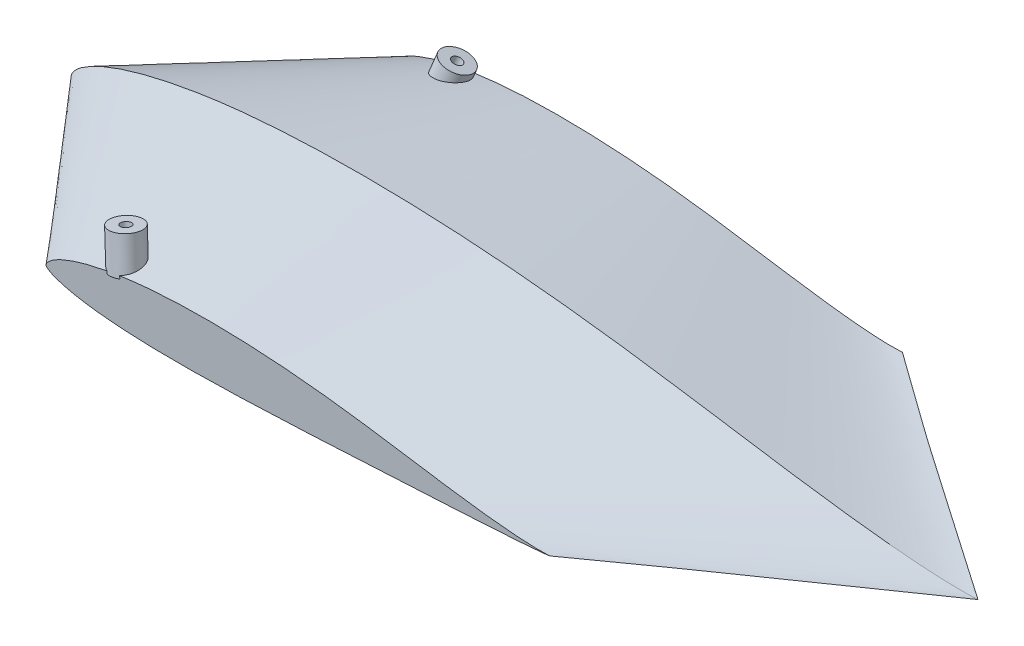
from build123d import *


with BuildPart() as part:
    # Body: read off the stored shape, not the designer's step
    # Body: loft between two sections, ruled curve by curve
    body_from = [
        Edge.make_bspline([(55.386771949, 11.883403368, 0), (55.852768765, 11.8868564, 0), (56.69562124, 11.89107863, 0), (59.94104569, 11.893656358, 0), (63.097215642, 11.853355335, 0), (68.366157994, 11.720868986, 0), (71.608923872, 11.59851596, 0), (77.026588338, 11.330029908, 0), (80.330447299, 11.126685225, 0), (85.847005897, 10.724944533, 0), (89.187094514, 10.443802673, 0), (94.75473633, 9.914693256, 0), (98.107627196, 9.559572712, 0), (103.681588987, 8.914690299, 0), (107.025673921, 8.495570086, 0), (112.562901545, 7.754939466, 0), (115.876650644, 7.284538974, 0), (121.334596116, 6.47861219, 0), (124.597392632, 5.979635356, 0), (129.924247429, 5.158494984, 0), (133.105917394, 4.66611092, 0), (138.229918356, 3.884653763, 0), (141.289972849, 3.425809537, 0), (146.12556764, 2.725195147, 0), (149.019747564, 2.320659658, 0), (153.479700678, 1.73306452, 0), (156.166253706, 1.400021675, 0), (160.153026967, 0.948983625, 0), (162.575234086, 0.699489944, 0), (166.008656714, 0.395886817, 0), (168.14749804, 0.234691756, 0), (170.900623314, 0.059264479, 0), (172.636575103, -0.035133887, 0), (174.735166131, -0.096211558, 0), (176.240928901, -0.109171411, 0), (177.443657202, -0.106955701, 0), (178.111324255, -0.102823971, 0), (178.692575161, -0.08298795, 0), (179.171022705, -0.054192073, 0), (179.705914343, -0.015962785, 0), (180.287534727, 0.029034431, 0), (179.41983786, -0.079190012, 0), (178.554256528, -0.191311882, 0), (177.734403332, -0.300407627, 0), (176.491964699, -0.431879969, 0), (174.691835688, -0.598099294, 0), (173.122720973, -0.722301039, 0), (170.809437199, -0.890644015, 0), (168.904268633, -1.022781588, 0), (165.920571198, -1.221295378, 0), (163.72362128, -1.360413519, 0), (160.179665219, -1.579480384, 0), (157.701595525, -1.729637928, 0), (153.623230876, -1.97266118, 0), (150.895153303, -2.132288806, 0), (146.345753164, -2.396056672, 0), (143.395613127, -2.565710461, 0), (138.434163256, -2.847752541, 0), (135.294196529, -3.023914124, 0), (129.986544453, -3.318842214, 0), (126.690069866, -3.500261624, 0), (121.104982217, -3.803854389, 0), (117.687513647, -3.987136439, 0), (111.89776573, -4.293629527, 0), (108.396548253, -4.476495579, 0), (102.477580795, -4.779250682, 0), (98.930780488, -4.95660358, 0), (92.959573997, -5.246695702, 0), (89.405980253, -5.41414178, 0), (83.459411347, -5.680855724, 0), (79.937050776, -5.830553211, 0), (74.090091141, -6.060795327, 0), (70.635861673, -6.185921231, 0), (64.959424417, -6.364933713, 0), (61.60728337, -6.45477053, 0), (56.165928072, -6.567217659, 0), (52.946479073, -6.614266161, 0), (47.798079896, -6.647306632, 0), (44.738678748, -6.642336362, 0), (39.933929516, -6.585936307, 0), (37.058156123, -6.524165358, 0), (32.64149365, -6.373849561, 0), (29.970676549, -6.250893361, 0), (25.98099515, -6.007108108, 0), (23.53348793, -5.822813571, 0), (20.004163285, -5.49109927, 0), (17.796276037, -5.244883205, 0), (14.754853341, -4.836637096, 0), (12.799889299, -4.533212775, 0), (10.270045435, -4.069656304, 0), (8.581347581, -3.716988448, 0), (6.586979055, -3.226447641, 0), (5.1807037, -2.83284361, 0), (3.739952211, -2.354956574, 0), (2.710801788, -1.965425391, 0), (1.97524414, -1.624570837, 0), (1.587735948, -1.420817945, 0), (1.34594803, -1.286938724, 0), (1.125729324, -1.156215034, 0), (0.935880593, -1.033338684, 0), (0.830512807, -0.961788322, 0), (0.736839333, -0.896352411, 0), (0.616620624, -0.808372944, 0), (0.519553217, -0.730934489, 0), (0.381481001, -0.614079034, 0), (0.288101728, -0.526787177, 0), (0.159180295, -0.380481821, 0), (0.076929066, -0.273589188, 0), (0.021915576, -0.155797955, 0), (-0.003466005, -0.044628629, 0), (-0.001633065, 0.085626904, 0), (0.057873164, 0.315835161, 0), (0.151614071, 0.522041136, 0), (0.276137416, 0.738604536, 0), (0.511935862, 1.088517205, 0), (0.996715371, 1.620829181, 0), (1.76013298, 2.273902068, 0), (2.824399816, 3.008266903, 0), (3.973909572, 3.670046578, 0), (5.54254929, 4.451573216, 0), (6.97471876, 5.065600577, 0), (9.043677576, 5.851293471, 0), (10.738427676, 6.414868774, 0), (13.288922977, 7.173313491, 0), (15.229725214, 7.681725206, 0), (18.238216005, 8.38720106, 0), (20.407556479, 8.834857167, 0), (23.843408677, 9.464545106, 0), (26.222677617, 9.843555786, 0), (30.053960093, 10.373668862, 0), (32.626340955, 10.673112228, 0), (36.822716684, 11.082650055, 0), (39.572058951, 11.297347101, 0), (44.100145874, 11.575668127, 0), (47.007269208, 11.704670259, 0), (51.362247986, 11.832903484, 0), (53.56285102, 11.869888129, 0), (55.386771949, 11.883403368, 0)], [0, 0, 0, 0, 0.003833429, 0.006933429, 0.02669708, 0.02979708, 0.050290098, 0.053390098, 0.074418303, 0.077518303, 0.098890395, 0.101990395, 0.123525188, 0.126625188, 0.14814885, 0.15124885, 0.17258157, 0.17568157, 0.196634381, 0.199734381, 0.220019886, 0.223119886, 0.242372939, 0.245472939, 0.263316714, 0.266416714, 0.282471263, 0.285571263, 0.299445276, 0.302545276, 0.313857938, 0.316957938, 0.325412787, 0.328512787, 0.333853157, 0.336953157, 0.338931106, 0.3406, 0.342031106, 0.342180142, 0.3437, 0.345280142, 0.346690499, 0.349790499, 0.35391197, 0.35701197, 0.363844606, 0.366944606, 0.376403979, 0.379503979, 0.391434562, 0.394534562, 0.408749538, 0.411849538, 0.428132732, 0.431232732, 0.449340879, 0.452440879, 0.472112248, 0.475212248, 0.496171182, 0.499271182, 0.521224922, 0.524324922, 0.54696643, 0.55006643, 0.573080114, 0.576180114, 0.599245624, 0.602345624, 0.62514787, 0.62824787, 0.650481982, 0.653581982, 0.674967352, 0.678067352, 0.698353756, 0.701453756, 0.72042038, 0.72352038, 0.740981358, 0.744081358, 0.759873573, 0.762973573, 0.776961874, 0.780061874, 0.792133285, 0.795233285, 0.805304457, 0.808404457, 0.81638728, 0.81948728, 0.825299011, 0.828399011, 0.831963921, 0.834324273, 0.835063921, 0.835564661, 0.836596336, 0.837168722, 0.837424273, 0.837643814, 0.838108431, 0.838649366, 0.838664661, 0.839594519, 0.839696336, 0.840268722, 0.840701999, 0.840743814, 0.841208431, 0.841749366, 0.842694519, 0.843060542, 0.843801999, 0.846160542, 0.848952704, 0.852052704, 0.85675218, 0.85985218, 0.866461296, 0.869561296, 0.878046999, 0.881146999, 0.891445777, 0.894545777, 0.90656294, 0.90966294, 0.923277977, 0.926377977, 0.941478014, 0.944578014, 0.961060385, 0.964160385, 0.981895882, 0.984995882, 1, 1, 1, 1], 3),
    ]
    body_to = [
        Edge.make_bspline([(61.398503394, 6.605335104, -35), (61.657396006, 6.606260191, -35), (62.125652412, 6.606835836, -35), (63.928651223, 6.60163665, -35), (65.681992456, 6.57312672, -35), (68.608917692, 6.489851366, -35), (70.410229938, 6.416135293, -35), (73.41956614, 6.257732568, -35), (75.254702124, 6.13932317, -35), (78.318803302, 5.907378116, -35), (80.173966346, 5.746022718, -35), (83.266287376, 5.443688046, -35), (85.128497374, 5.241647014, -35), (88.224270727, 4.875974842, -35), (90.081575847, 4.639012736, -35), (93.156958238, 4.221272064, -35), (94.997490124, 3.956836684, -35), (98.029076538, 3.50507474, -35), (99.841535363, 3.226519805, -35), (102.800818226, 2.769868228, -35), (104.568491605, 2.496796386, -35), (107.415490827, 2.064627211, -35), (109.115773738, 1.811568367, -35), (111.802700236, 1.426335302, -35), (113.411100338, 1.204770147, -35), (115.890013331, 0.884426116, -35), (117.382794913, 0.704007469, -35), (119.597380645, 0.461656585, -35), (120.944766603, 0.329215379, -35), (122.857304755, 0.170880506, -35), (124.042062081, 0.087737133, -35), (125.558359755, -0.001337788, -35), (126.537278686, -0.043642645, -35), (127.746363574, -0.060392267, -35), (128.533135663, -0.060159411, -35), (129.084829616, -0.056103681, -35), (129.603987944, -0.027383391, -35), (130.159369784, 0.016819605, -35), (129.844351157, -0.023207169, -35), (129.554454032, -0.059928014, -35), (129.301246405, -0.092788038, -35), (129.027092616, -0.128821436, -35), (128.685612531, -0.171664495, -35), (128.125588016, -0.232680738, -35), (127.386592945, -0.301853671, -35), (126.423984105, -0.383002658, -35), (125.56538362, -0.446378997, -35), (124.267607847, -0.538611549, -35), (123.20527007, -0.610723357, -35), (121.55136335, -0.718579809, -35), (120.331835547, -0.79472448, -35), (118.361774913, -0.915640924, -35), (116.984739082, -0.998545059, -35), (114.719267456, -1.132761726, -35), (113.203730175, -1.22107483, -35), (110.676170616, -1.367270715, -35), (109.037165206, -1.461246148, -35), (106.280799358, -1.617378334, -35), (104.536363055, -1.714950212, -35), (101.587637635, -1.878396375, -35), (99.756245297, -1.978895607, -35), (96.653390675, -2.147001687, -35), (94.754779686, -2.24849336, -35), (91.538223497, -2.418220393, -35), (89.593080267, -2.519383242, -35), (86.304719474, -2.686687814, -35), (84.334244554, -2.784609295, -35), (81.016851518, -2.944625318, -35), (79.04259109, -3.036755013, -35), (75.738858066, -3.183072669, -35), (73.781936179, -3.264933824, -35), (70.533525227, -3.390342343, -35), (68.614442577, -3.457967344, -35), (65.460745618, -3.553639961, -35), (63.59837769, -3.600940134, -35), (60.575299588, -3.658562488, -35), (58.786672646, -3.68124556, -35), (55.926407012, -3.693138355, -35), (54.226755163, -3.685961414, -35), (51.557539525, -3.646789066, -35), (49.960020883, -3.606985123, -35), (47.506646642, -3.513825896, -35), (46.023190677, -3.438797709, -35), (43.807395819, -3.291998357, -35), (42.448331883, -3.181312131, -35), (40.488893014, -2.983125752, -35), (39.263504875, -2.836070799, -35), (37.576062375, -2.592928852, -35), (36.492020507, -2.411628831, -35), (35.090005676, -2.134686844, -35), (34.155664551, -1.922021957, -35), (33.054034643, -1.625124227, -35), (32.279516812, -1.382713081, -35), (31.488422647, -1.085898931, -35), (30.935097899, -0.828870453, -35), (30.54773045, -0.597713832, -35), (30.35031197, -0.455510873, -35), (30.230624197, -0.359330689, -35), (30.126799864, -0.261239223, -35), (30.050071438, -0.161523953, -35), (30.017271688, -0.097723015, -35), (29.997901648, -0.037073054, -35), (29.999092742, 0.047570502, -35), (30.016393262, 0.114500011, -35), (30.047792032, 0.209868574, -35), (30.077299289, 0.274587387, -35), (30.129555699, 0.369654747, -35), (30.168697758, 0.433485867, -35), (30.209111431, 0.491620883, -35), (30.246506837, 0.542925655, -35), (30.28952686, 0.599105917, -35), (30.374048733, 0.700302848, -35), (30.459556148, 0.791999747, -35), (30.557901574, 0.890086, -35), (30.728209858, 1.051079495, -35), (31.036202599, 1.304084329, -35), (31.497685046, 1.62033508, -35), (32.112251999, 1.988005747, -35), (32.768545637, 2.322733294, -35), (33.655041686, 2.724693105, -35), (34.460589738, 3.042345143, -35), (35.619152751, 3.45284145, -35), (36.56642642, 3.748194571, -35), (37.989497811, 4.147940238, -35), (39.071370122, 4.416259785, -35), (40.746877125, 4.789752767, -35), (41.954467385, 5.026609087, -35), (43.866187011, 5.359926559, -35), (45.189655047, 5.559912742, -35), (47.3202247, 5.83874107, -35), (48.750426206, 5.995461164, -35), (51.083064823, 6.208689644, -35), (52.611130157, 6.319413834, -35), (55.127463587, 6.461275274, -35), (56.742856318, 6.525355264, -35), (59.162559205, 6.58612855, -35), (60.385192492, 6.601714298, -35), (61.398503394, 6.605335104, -35)], [0, 0, 0, 0, 0.003833429, 0.006933429, 0.02669708, 0.02979708, 0.050290098, 0.053390098, 0.074418303, 0.077518303, 0.098890395, 0.101990395, 0.123525188, 0.126625188, 0.14814885, 0.15124885, 0.17258157, 0.17568157, 0.196634381, 0.199734381, 0.220019886, 0.223119886, 0.242372939, 0.245472939, 0.263316714, 0.266416714, 0.282471263, 0.285571263, 0.299445276, 0.302545276, 0.313857938, 0.316957938, 0.325412787, 0.328512787, 0.333853157, 0.336953157, 0.338931106, 0.3406, 0.342031106, 0.342180142, 0.3437, 0.345280142, 0.346690499, 0.349790499, 0.35391197, 0.35701197, 0.363844606, 0.366944606, 0.376403979, 0.379503979, 0.391434562, 0.394534562, 0.408749538, 0.411849538, 0.428132732, 0.431232732, 0.449340879, 0.452440879, 0.472112248, 0.475212248, 0.496171182, 0.499271182, 0.521224922, 0.524324922, 0.54696643, 0.55006643, 0.573080114, 0.576180114, 0.599245624, 0.602345624, 0.62514787, 0.62824787, 0.650481982, 0.653581982, 0.674967352, 0.678067352, 0.698353756, 0.701453756, 0.72042038, 0.72352038, 0.740981358, 0.744081358, 0.759873573, 0.762973573, 0.776961874, 0.780061874, 0.792133285, 0.795233285, 0.805304457, 0.808404457, 0.81638728, 0.81948728, 0.825299011, 0.828399011, 0.831963921, 0.834324273, 0.835063921, 0.835564661, 0.836596336, 0.837168722, 0.837424273, 0.837643814, 0.838108431, 0.838649366, 0.838664661, 0.839594519, 0.839696336, 0.840268722, 0.840701999, 0.840743814, 0.841208431, 0.841749366, 0.842694519, 0.843060542, 0.843801999, 0.846160542, 0.848952704, 0.852052704, 0.85675218, 0.85985218, 0.866461296, 0.869561296, 0.878046999, 0.881146999, 0.891445777, 0.894545777, 0.90656294, 0.90966294, 0.923277977, 0.926377977, 0.941478014, 0.944578014, 0.961060385, 0.964160385, 0.981895882, 0.984995882, 1, 1, 1, 1], 3),
    ]
    body = Solid(Shell([*[Face.make_surface_from_curves(body_from[k], body_to[k]) for k in range(1)], Face(Wire(body_from)), Face(Wire(body_to))]))
    add(body)

    # MirrorBody: part across plane


with BuildPart() as part_1:
    add(part.part)
    add(part.part.mirror(Plane.XY))

    # Sketch8 → Revolve2 (revolve)
    with BuildSketch(Plane(origin=(0, 0, 0), x_dir=(0.8022929282893954, 0, 0.5969305296404492), z_dir=(-0.5969305296404492, 0, 0.8022929282893954)), mode=Mode.PRIVATE) as revolve2_sk:
        Polygon((49.964061673, 10.966689098), (51.933677179, 11.313985454), (53.167966044, 4.313985454), (51.198350538, 3.966689098), align=None)
    revolve(revolve2_sk.sketch.rotate(Axis((48.393369582, -30.481800548, 36.006150269), (-0.13931670495251344, 0.9848077530122092, -0.10365589866581566)), 216.231245664), axis=Axis((48.393369582, -30.481800548, 36.006150269), (-0.13931670495251344, 0.9848077530122092, -0.10365589866581566)))


with BuildPart() as body_2:
    # Sketch6 → Revolve1 (revolve)
    with BuildSketch(Plane(origin=(0, 0, 0), x_dir=(0.8022929282893954, 0, -0.5969305296404492), z_dir=(0.5969305296404492, 0, 0.8022929282893954)), mode=Mode.PRIVATE) as revolve1_sk:
        Polygon((57.587190085, 7.208343245), (55.707804843, 7.892383532), (53.31366384, 1.314535186), (55.193049081, 0.6304949), align=None)
    revolve(revolve1_sk.sketch.rotate(Axis((34.008390492, -25.776942853, -25.303284913), (0.27440034232271016, 0.9396926207859081, -0.2041622653030943)), 325.040289205), axis=Axis((34.008390492, -25.776942853, -25.303284913), (0.27440034232271016, 0.9396926207859081, -0.2041622653030943)))


solid = Compound([part_1.part, body_2.part])
